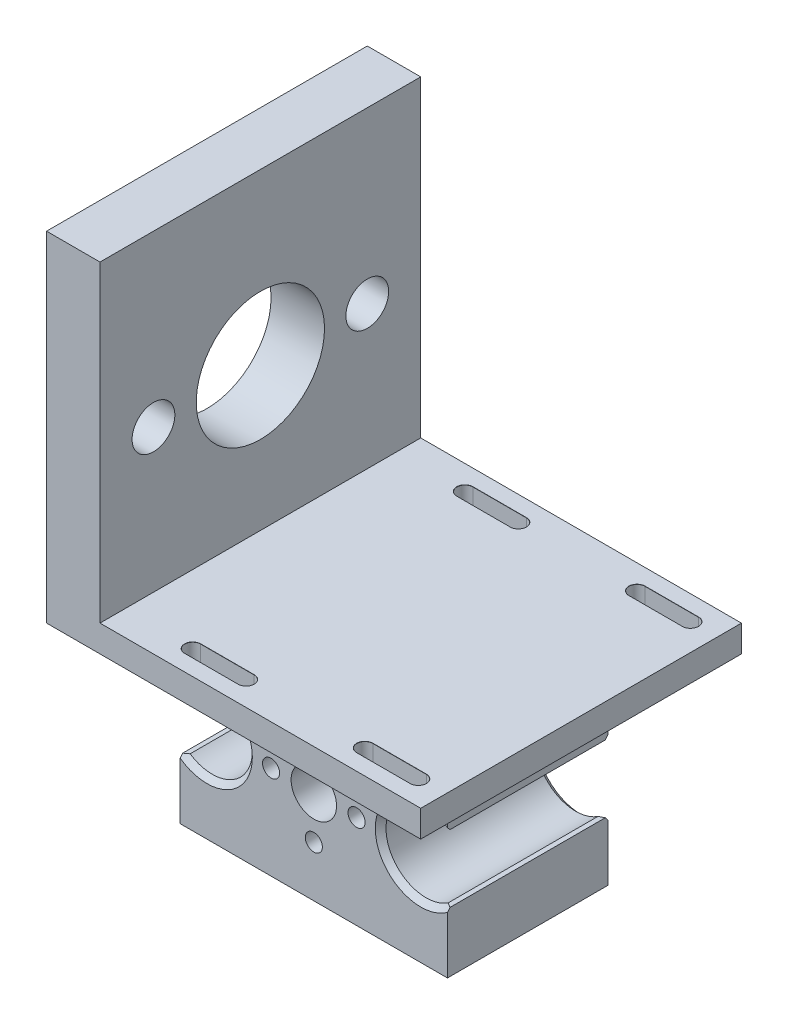
from build123d import *

# Parameters (mm, degrees)
SKETCH_1_W               = 50
SKETCH_1_H               = 35
EXTRUDE_1_DEPTH          = 30
HOLE_WIZARD_362_D        = 8.5
HOLE_WIZARD_467_D        = 3.2
HOLE_WIZARD_621_D        = 15
CHAMFER_1_SIZE           = 1
CHAMFER_1_SIZE_2         = 0.708203932
SKETCH_8_W               = 70
SKETCH_8_H               = 60
SKETCH_8_W_2             = 50
SKETCH_8_H_2             = 30
EXTRUDE_2_DEPTH          = 63.5
HOLE_WIZARD_1_D          = 24
HOLE_WIZARD_2_D          = 8
CHAMFER_2_SIZE           = 0.25
CUT_EXTRUDE_2_DEPTH      = 107.705201373
CUT_EXTRUDE_2_DEPTH_BACK = 107.705201373
SKETCH_14_W              = 60
SKETCH_14_H              = 58.5
MM_START                 = 17
MM_2_DEPTH               = 5.5
RIB_1_REACH              = 95.199
SKETCH_25_WALL_W         = 201.46144539
SKETCH_25_WALL_H         = 30
RIB_2_REACH              = 101.05
SKETCH_26_WALL_W         = 216.17250262
SKETCH_26_WALL_H         = 15
RIB_4_REACH              = 108.5
SKETCH_27_WALL_W         = 231.071518272
SKETCH_27_WALL_H         = 7


with BuildPart() as part:
    # 草图1 → 凸台-拉伸1 (new body)
    with BuildSketch(Plane.XY):
        Rectangle(SKETCH_1_W, SKETCH_1_H)
    extrude(amount=EXTRUDE_1_DEPTH)

    # Hole Wizard 362 (through all)
    with Locations(Plane.XY.offset(30)):
        with Locations((0, 0)):
            Hole(HOLE_WIZARD_362_D / 2)

    # Hole Wizard 467 (through all)
    with Locations(Plane.XY.offset(30)):
        with Locations((8, 0), (0, 8), (-8, 0), (0, -8)):
            Hole(HOLE_WIZARD_467_D / 2)

    # Hole Wizard 621 (through all)
    with Locations(Plane.XY.offset(30)):
        with Locations((20, 0), (-20, 0)):
            Hole(HOLE_WIZARD_621_D / 2)

    # 倒角1
    # the kernel refuses this chamfer: 1, 0.708203932 mm, written as the material it takes off along each edge
    with BuildSketch(Plane(origin=(-20, 0, 0), x_dir=(-0.8790200859122482, 0.4767847402789059, 0), z_dir=(-0.4767847402789059, -0.8790200859122482, 0))) as chamfer_1_piece_1:
        Polygon((7.5, -CHAMFER_1_SIZE), (7.5 + CHAMFER_1_SIZE, 0), (7.5, 0), align=None)
    revolve(axis=Axis((-20, 0, 0), (0, 0, -1)), revolution_arc=303.048763938, mode=Mode.SUBTRACT)
    with BuildSketch(Plane(origin=(-20, 0, 30), x_dir=(-0.879020085912248, 0.47678474027890627, 0), z_dir=(-0.47678474027890627, -0.879020085912248, 0))) as chamfer_1_piece_2:
        Polygon((7.5 + CHAMFER_1_SIZE, 0), (7.5, CHAMFER_1_SIZE), (7.5, 0), align=None)
    revolve(axis=Axis((-20, 0, 30), (0, 0, -1)), revolution_arc=303.048763938, mode=Mode.SUBTRACT)
    with BuildSketch(Plane(origin=(20, 0, 30), x_dir=(0.879020085912248, -0.4767847402789061, 0), z_dir=(0.4767847402789061, 0.879020085912248, 0))) as chamfer_1_piece_3:
        Polygon((7.5 + CHAMFER_1_SIZE, 0), (7.5, CHAMFER_1_SIZE), (7.5, 0), align=None)
    revolve(axis=Axis((20, 0, 30), (0, 0, -1)), revolution_arc=303.048763938, mode=Mode.SUBTRACT)
    with BuildSketch(Plane(origin=(20, 0, 0), x_dir=(0.8790200859122481, 0.476784740278906, 0), z_dir=(0.476784740278906, -0.8790200859122481, 0))) as chamfer_1_piece_4:
        Polygon((7.5, CHAMFER_1_SIZE), (7.5 + CHAMFER_1_SIZE, 0), (7.5, 0), align=None)
    revolve(axis=Axis((20, 0, 0), (0, 0, 1)), revolution_arc=303.048763938, mode=Mode.SUBTRACT)
    with BuildSketch(Plane(origin=(-25, 5.590169944, 32.778051389), x_dir=(0.7914486393779661, 0.611235675682274, 0), z_dir=(0, 0, -1)), Plane(origin=(25, -5.590169944, 32.778051389), x_dir=(-0.7914486393779661, -0.611235675682274, 0), z_dir=(0, 0, -1))) as chamfer_1_piece_5:
        with BuildLine():
            Line((1.080663788, 0), (CHAMFER_1_SIZE_2 * 0.611235676113, -CHAMFER_1_SIZE_2 * 0.791448639936))
            Line((CHAMFER_1_SIZE_2 * 0.611235676113, -CHAMFER_1_SIZE_2 * 0.791448639936), (0, 0))
            ThreePointArc((0, 0), (0.555522087, -0.019473843), (1.080663788, 0))
        make_face()
    extrude(amount=35.556102778, mode=Mode.SUBTRACT)
    with BuildSketch(Plane(origin=(-25, -5.590169944, 32.778051389), x_dir=(0.7914486393779665, -0.6112356756822735, 0), z_dir=(0, 0, -1))) as chamfer_1_piece_6:
        with BuildLine():
            Line((1.080663788, 0), (CHAMFER_1_SIZE_2 * 0.611235676113, CHAMFER_1_SIZE_2 * 0.791448639936))
            Line((CHAMFER_1_SIZE_2 * 0.611235676113, CHAMFER_1_SIZE_2 * 0.791448639936), (0, 0))
            ThreePointArc((0, 0), (0.555522087, 0.019473843), (1.080663788, 0))
        make_face()
    extrude(amount=35.556102778, mode=Mode.SUBTRACT)
    with BuildSketch(Plane(origin=(25, 5.590169944, 32.778051389), x_dir=(0, 1, 0), z_dir=(0, 0, -1))) as chamfer_1_piece_7:
        with BuildLine():
            Line((CHAMFER_1_SIZE_2, 0), (0.660540261, -0.855289885))
            ThreePointArc((0.660540261, -0.855289885), (0.354967464, -0.427764092), (0, 0))
            Line((0, 0), (CHAMFER_1_SIZE_2, 0))
        make_face()
    extrude(amount=35.556102778, mode=Mode.SUBTRACT)

    # 草图8 → 凸台-拉伸2 (add)
    # profile 1 of 5: a face of its own
    with BuildSketch(Plane(origin=(0, 17.5, 0), x_dir=(1, 0, 0), z_dir=(0, 1, 0))):
        with Locations((0, -15)):
            Rectangle(SKETCH_8_W, SKETCH_8_H)
        with Locations((0, -15)):
            Rectangle(SKETCH_8_W_2, SKETCH_8_H_2, mode=Mode.SUBTRACT)
    # profile 2 of 5: a face of its own
    with BuildSketch(Plane(origin=(0, 17.5, 0), x_dir=(1, 0, 0), z_dir=(0, 1, 0))):
        Polygon((25, 0), (0, -15), (25, -30), align=None)
    # profile 3 of 5: a face of its own
    with BuildSketch(Plane(origin=(0, 17.5, 0), x_dir=(1, 0, 0), z_dir=(0, 1, 0))):
        Polygon((25, -30), (0, -15), (-25, -30), align=None)
    # profile 4 of 5: a face of its own
    with BuildSketch(Plane(origin=(0, 17.5, 0), x_dir=(1, 0, 0), z_dir=(0, 1, 0))):
        Polygon((0, -15), (-25, 0), (-25, -30), align=None)
    # profile 5 of 5: a face of its own
    with BuildSketch(Plane(origin=(0, 17.5, 0), x_dir=(1, 0, 0), z_dir=(0, 1, 0))):
        Polygon((25, 0), (-25, 0), (0, -15), align=None)
    extrude(amount=EXTRUDE_2_DEPTH)

    # 孔1 (through all)
    with Locations(Plane(origin=(35, 0, 0), x_dir=(0, 0, -1), z_dir=(1, 0, 0))):
        with Locations((-15, 49.25)):
            Hole(HOLE_WIZARD_1_D / 2)

    # 孔2 (through all)
    with Locations(Plane(origin=(35, 0, 0), x_dir=(0, 0, -1), z_dir=(1, 0, 0))):
        with Locations((5, 49.25), (-35, 49.25)):
            Hole(HOLE_WIZARD_2_D / 2)

    # 倒角2
    chamfer_2_edges = [part.edges().sort_by_distance(p)[0] for p in [
        (-35, 49.25, 31),
        (-35, 49.25, -9),
    ]]
    chamfer(chamfer_2_edges, length=CHAMFER_2_SIZE)

    # 草图14 → 切除-拉伸2 (cut, two sides: drawn at the far end of the back side and taken through both)
    with BuildSketch(Plane.XY.offset(45).offset(-CUT_EXTRUDE_2_DEPTH_BACK)):
        with Locations((5, 51.75)):
            Rectangle(SKETCH_14_W, SKETCH_14_H)
    extrude(amount=CUT_EXTRUDE_2_DEPTH + CUT_EXTRUDE_2_DEPTH_BACK, mode=Mode.SUBTRACT)

    # 大小mm 暗销槽口2: read off the stored shape, not the designer's step
    # 大小mm 暗销槽口2 outline → 大小mm 暗销槽口2 (cut)
    with BuildSketch(Plane(origin=(0, 0, 0), x_dir=(1, 0, 0), z_dir=(0, 1, 0)).offset(MM_START)):
        with BuildLine():
            Line((30, 11.959259259), (20, 11.959259259))
            ThreePointArc((20, 11.959259259), (18.5, 10.459259259), (20, 8.959259259))
            Line((20, 8.959259259), (30, 8.959259259))
            ThreePointArc((30, 8.959259259), (31.5, 10.459259259), (30, 11.959259259))
        make_face()
        with BuildLine():
            ThreePointArc((-12.203065134, 11.959259259), (-13.703065134, 10.459259259), (-12.203065134, 8.959259259))
            Line((-12.203065134, 8.959259259), (-2.203065134, 8.959259259))
            ThreePointArc((-2.203065134, 8.959259259), (-0.703065134, 10.459259259), (-2.203065134, 11.959259259))
            Line((-2.203065134, 11.959259259), (-12.203065134, 11.959259259))
        make_face()
    mm_2 = extrude(amount=MM_2_DEPTH, mode=Mode.SUBTRACT)

    # mm _2 2: loft between two sections, ruled curve by curve
    mm_2_2_from = [
        Edge.make_three_point_arc((30, 22.475, -8.959259259), (31.060660172, 22.475, -9.398599087), (31.5, 22.475, -10.459259259)),
        Edge.make_three_point_arc((31.5, 22.475, -10.459259259), (31.060660172, 22.475, -11.519919431), (30, 22.475, -11.959259259)),
        Edge.make_three_point_arc((20, 22.475, -11.959259259), (18.939339828, 22.475, -11.519919431), (18.5, 22.475, -10.459259259)),
        Edge.make_three_point_arc((18.5, 22.475, -10.459259259), (18.939339828, 22.475, -9.398599087), (20, 22.475, -8.959259259)),
        Edge.make_line((30, 22.475, -11.959259259), (20, 22.475, -11.959259259)),
        Edge.make_line((30, 22.475, -8.959259259), (20, 22.475, -8.959259259)),
    ]
    mm_2_2_to = [
        Edge.make_three_point_arc((30, 22.5, -8.934259259), (31.078337841, 22.5, -9.380921418), (31.525, 22.5, -10.459259259)),
        Edge.make_three_point_arc((31.525, 22.5, -10.459259259), (31.078337841, 22.5, -11.537597101), (30, 22.5, -11.984259259)),
        Edge.make_three_point_arc((20, 22.5, -11.984259259), (18.921662159, 22.5, -11.537597101), (18.475, 22.5, -10.459259259)),
        Edge.make_three_point_arc((18.475, 22.5, -10.459259259), (18.921662159, 22.5, -9.380921418), (20, 22.5, -8.934259259)),
        Edge.make_line((30, 22.5, -11.984259259), (20, 22.5, -11.984259259)),
        Edge.make_line((30, 22.5, -8.934259259), (20, 22.5, -8.934259259)),
    ]
    mm_2_2 = Solid(Shell([*[Face.make_surface_from_curves(mm_2_2_from[k], mm_2_2_to[k]) for k in range(6)], Face(Wire(mm_2_2_from)), Face(Wire(mm_2_2_to))]))
    add(mm_2_2, mode=Mode.SUBTRACT)

    # mm _2 3: loft between two sections, ruled curve by curve
    mm_2_3_from = [
        Edge.make_three_point_arc((-2.203065134, 22.475, -8.959259259), (-1.142404962, 22.475, -9.398599087), (-0.703065134, 22.475, -10.459259259)),
        Edge.make_three_point_arc((-0.703065134, 22.475, -10.459259259), (-1.142404962, 22.475, -11.519919431), (-2.203065134, 22.475, -11.959259259)),
        Edge.make_three_point_arc((-12.203065134, 22.475, -11.959259259), (-13.263725306, 22.475, -11.519919431), (-13.703065134, 22.475, -10.459259259)),
        Edge.make_three_point_arc((-13.703065134, 22.475, -10.459259259), (-13.263725306, 22.475, -9.398599087), (-12.203065134, 22.475, -8.959259259)),
        Edge.make_line((-2.203065134, 22.475, -11.959259259), (-12.203065134, 22.475, -11.959259259)),
        Edge.make_line((-2.203065134, 22.475, -8.959259259), (-12.203065134, 22.475, -8.959259259)),
    ]
    mm_2_3_to = [
        Edge.make_three_point_arc((-2.203065134, 22.5, -8.934259259), (-1.124727293, 22.5, -9.380921418), (-0.678065134, 22.5, -10.459259259)),
        Edge.make_three_point_arc((-0.678065134, 22.5, -10.459259259), (-1.124727293, 22.5, -11.537597101), (-2.203065134, 22.5, -11.984259259)),
        Edge.make_three_point_arc((-12.203065134, 22.5, -11.984259259), (-13.281402975, 22.5, -11.537597101), (-13.728065134, 22.5, -10.459259259)),
        Edge.make_three_point_arc((-13.728065134, 22.5, -10.459259259), (-13.281402975, 22.5, -9.380921418), (-12.203065134, 22.5, -8.934259259)),
        Edge.make_line((-2.203065134, 22.5, -11.984259259), (-12.203065134, 22.5, -11.984259259)),
        Edge.make_line((-2.203065134, 22.5, -8.934259259), (-12.203065134, 22.5, -8.934259259)),
    ]
    mm_2_3 = Solid(Shell([*[Face.make_surface_from_curves(mm_2_3_from[k], mm_2_3_to[k]) for k in range(6)], Face(Wire(mm_2_3_from)), Face(Wire(mm_2_3_to))]))
    add(mm_2_3, mode=Mode.SUBTRACT)

    # 镜向1: 大小mm 暗销槽口2, mm _2 2, mm _2 3 across plane
    add(mm_2.mirror(Plane(origin=(0, 0, 15), x_dir=(1, 0, 0), z_dir=(0, 0, -1))), mode=Mode.SUBTRACT)
    add(mm_2_2.mirror(Plane(origin=(0, 0, 15), x_dir=(1, 0, 0), z_dir=(0, 0, -1))), mode=Mode.SUBTRACT)
    add(mm_2_3.mirror(Plane(origin=(0, 0, 15), x_dir=(1, 0, 0), z_dir=(0, 0, -1))), mode=Mode.SUBTRACT)

    # 草图25 wall → 筋1 (add, up to next)
    with BuildSketch(Plane(origin=(-30, 13.296768148, 15), x_dir=(-0.765461137236, 0.6434821267, 0), z_dir=(0.6434821267, 0.765461137236, 0)), mode=Mode.PRIVATE) as rib_1_sk1:
        Rectangle(SKETCH_25_WALL_W, SKETCH_25_WALL_H)
    rib_1_tool1 = extrude(rib_1_sk1.sketch, amount=RIB_1_REACH, mode=Mode.PRIVATE) - part.part
    rib_1 = rib_1_tool1.solids().sort_by_distance((-30, 13.296768148, 15))[0]
    add(rib_1)

    # 镜向2: 筋1 across plane
    add(rib_1.mirror(Plane(origin=(0, 0, 0), x_dir=(0, 0, 1), z_dir=(1, 0, 0))))

    # 草图26 wall → 筋2 (add, up to next)
    with BuildSketch(Plane(origin=(0, 14.614965359, 37.5), x_dir=(0, 0.359024529342, 0.933328124151), z_dir=(0, -0.933328124151, 0.359024529342)), mode=Mode.PRIVATE) as rib_2_sk1:
        with Locations((0, -7.5)):
            Rectangle(SKETCH_26_WALL_W, SKETCH_26_WALL_H)
    rib_2_tool1 = extrude(rib_2_sk1.sketch, amount=-RIB_2_REACH, mode=Mode.PRIVATE) - part.part
    rib_2 = rib_2_tool1.solids().sort_by_distance((0, 14.614965359, 37.5))[0]
    add(rib_2)

    # 草图27 wall → 筋4 (add, up to next)
    with BuildSketch(Plane(origin=(-17.5, 14.614965359, 37.5), x_dir=(0, -0.359024529342, -0.933328124151), z_dir=(0, 0.933328124151, -0.359024529342)), mode=Mode.PRIVATE) as rib_4_sk1:
        with Locations((0, 3.5)):
            Rectangle(SKETCH_27_WALL_W, SKETCH_27_WALL_H)
    rib_4_tool1 = extrude(rib_4_sk1.sketch, amount=RIB_4_REACH, mode=Mode.PRIVATE) - part.part
    rib_4 = rib_4_tool1.solids().sort_by_distance((-17.5, 14.614965359, 37.5))[0]
    add(rib_4)

    # 镜向4: 筋2, 筋4 across plane
    add(rib_2.mirror(Plane(origin=(0, 0, 15), x_dir=(1, 0, 0), z_dir=(0, 0, -1))))
    add(rib_4.mirror(Plane(origin=(0, 0, 15), x_dir=(1, 0, 0), z_dir=(0, 0, -1))))


solid = part.part
